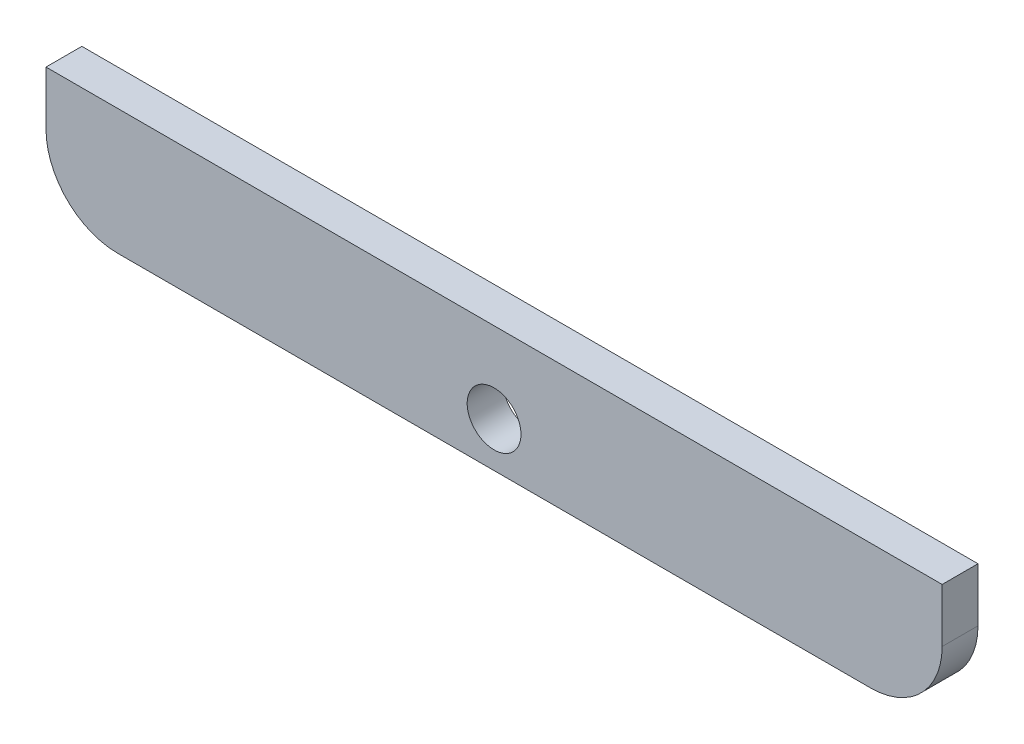
from build123d import *

# Parameters (mm, degrees)
SKETCH1_R           = 1.5
BOSS_EXTRUDE1_DEPTH = 1


with BuildPart() as part:
    # Sketch1 → Boss-Extrude1 (new, symmetric)
    with BuildSketch(Plane.XY):
        with BuildLine():
            Line((-21, -2.5), (21, -2.5))
            ThreePointArc((21, -2.5), (23.828427125, -1.328427125), (25, 1.5))
            Line((25, 1.5), (25, 4.5))
            Line((25, 4.5), (-25, 4.5))
            Line((-25, 4.5), (-25, 1.5))
            ThreePointArc((-25, 1.5), (-23.828427125, -1.328427125), (-21, -2.5))
        make_face()
        Circle(SKETCH1_R, mode=Mode.SUBTRACT)
    extrude(amount=BOSS_EXTRUDE1_DEPTH, both=True)


solid = part.part
